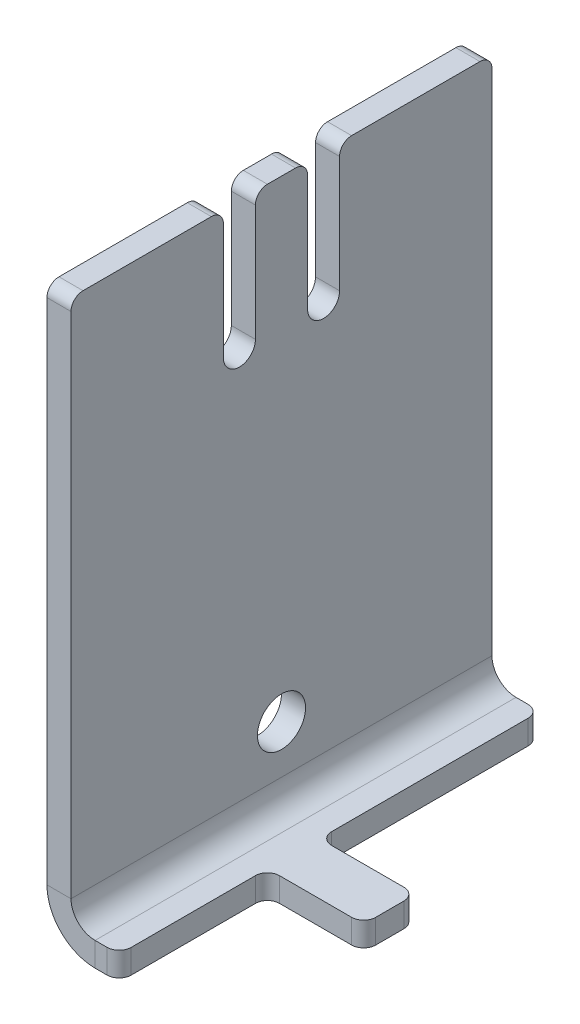
from build123d import *

# Parameters (mm, degrees)
BASE_FLANGE1_DEPTH       = 2
SKETCHED_BEND1_OUTLINE_W = 2
SKETCHED_BEND1_OUTLINE_H = 35
SKETCHED_BEND1_DEPTH     = 44.40715449
SKETCHED_START           = 45.98523449
SKETCHED_BEND1_2_DEPTH   = 0.01096
SKETCHED_START_2         = 43.99619449
SKETCHED_BEND1_3_DEPTH   = 4
SKETCHED_START_3         = -17.5
SKETCHED_BEND1_4_DEPTH   = 35
SKETCH7_R                = 2
CUT_EXTRUDE1_DEPTH       = 10


with BuildPart() as part:
    # Base-Flange1: sheet metal written as solids
    # Sketch1 → Base-Flange1 (new body)
    with BuildSketch(Plane(origin=(0, 0, 0), x_dir=(1, 0, 0), z_dir=(0, 1, 0))):
        with BuildLine():
            Line((0, 16.5), (0, 5.83))
            ThreePointArc((0, 5.83), (0.292893219, 5.122893219), (1, 4.83))
            Line((1, 4.83), (10.67, 4.83))
            ThreePointArc((10.67, 4.83), (12, 3.5), (10.67, 2.17))
            Line((10.67, 2.17), (1, 2.17))
            ThreePointArc((1, 2.17), (0.292893219, 1.877106781), (0, 1.17))
            Line((0, 1.17), (0, -1.17))
            ThreePointArc((0, -1.17), (0.292893219, -1.877106781), (1, -2.17))
            Line((1, -2.17), (10.67, -2.17))
            ThreePointArc((10.67, -2.17), (12, -3.5), (10.67, -4.83))
            Line((10.67, -4.83), (1, -4.83))
            ThreePointArc((1, -4.83), (0.292893219, -5.122893219), (0, -5.83))
            Line((0, -5.83), (0, -16.5))
            ThreePointArc((0, -16.5), (0.292893219, -17.207106781), (1, -17.5))
            Line((1, -17.5), (49, -17.5))
            ThreePointArc((49, -17.5), (49.707106781, -17.207106781), (50, -16.5))
            Line((50, -16.5), (50, -6.17))
            ThreePointArc((50, -6.17), (50.292893219, -5.462893219), (51, -5.17))
            Line((51, -5.17), (57, -5.17))
            ThreePointArc((57, -5.17), (57.707106781, -4.877106781), (58, -4.17))
            Line((58, -4.17), (58, -1.83))
            ThreePointArc((58, -1.83), (57.707106781, -1.122893219), (57, -0.83))
            Line((57, -0.83), (51, -0.83))
            ThreePointArc((51, -0.83), (50.292893219, -0.537106781), (50, 0.17))
            Line((50, 0.17), (50, 16.5))
            ThreePointArc((50, 16.5), (49.707106781, 17.207106781), (49, 17.5))
            Line((49, 17.5), (1, 17.5))
            ThreePointArc((1, 17.5), (0.292893219, 17.207106781), (0, 16.5))
        make_face()
    extrude(amount=-BASE_FLANGE1_DEPTH)

    # Sketched Bend1: read off the stored shape, not the designer's step
    # Sketched Bend1 outline → Sketched Bend1 (cut)
    with BuildSketch(Plane.YZ):
        with Locations((-1, 0)):
            Rectangle(SKETCHED_BEND1_OUTLINE_W, SKETCHED_BEND1_OUTLINE_H)
    extrude(amount=SKETCHED_BEND1_DEPTH, mode=Mode.SUBTRACT)

    # Sketched Bend1 2 outline → Sketched Bend1 2 (add)
    with BuildSketch(Plane.YZ.offset(SKETCHED_START)):
        with BuildLine():
            Line((0, -17.5), (44.28380551, -17.5))
            ThreePointArc((44.28380551, -17.5), (44.990912291, -17.207106781), (45.28380551, -16.5))
            Line((45.28380551, -16.5), (45.28380551, -5.83))
            ThreePointArc((45.28380551, -5.83), (44.990912291, -5.122893219), (44.28380551, -4.83))
            Line((44.28380551, -4.83), (34.61380551, -4.83))
            ThreePointArc((34.61380551, -4.83), (33.28380551, -3.5), (34.61380551, -2.17))
            Line((34.61380551, -2.17), (44.28380551, -2.17))
            ThreePointArc((44.28380551, -2.17), (44.990912291, -1.877106781), (45.28380551, -1.17))
            Line((45.28380551, -1.17), (45.28380551, 1.17))
            ThreePointArc((45.28380551, 1.17), (44.990912291, 1.877106781), (44.28380551, 2.17))
            Line((44.28380551, 2.17), (34.61380551, 2.17))
            ThreePointArc((34.61380551, 2.17), (33.28380551, 3.5), (34.61380551, 4.83))
            Line((34.61380551, 4.83), (44.28380551, 4.83))
            ThreePointArc((44.28380551, 4.83), (44.990912291, 5.122893219), (45.28380551, 5.83))
            Line((45.28380551, 5.83), (45.28380551, 16.5))
            ThreePointArc((45.28380551, 16.5), (44.990912291, 17.207106781), (44.28380551, 17.5))
            Line((44.28380551, 17.5), (0, 17.5))
            Line((0, 17.5), (0, -17.5))
        make_face()
    extrude(amount=SKETCHED_BEND1_2_DEPTH)

    # Sketched Bend1 3 outline → Sketched Bend1 3 (add)
    with BuildSketch(Plane.YZ.offset(SKETCHED_START_2)):
        with BuildLine():
            Line((0, -17.5), (44.28380551, -17.5))
            ThreePointArc((44.28380551, -17.5), (44.990912291, -17.207106781), (45.28380551, -16.5))
            Line((45.28380551, -16.5), (45.28380551, -5.83))
            ThreePointArc((45.28380551, -5.83), (44.990912291, -5.122893219), (44.28380551, -4.83))
            Line((44.28380551, -4.83), (34.61380551, -4.83))
            ThreePointArc((34.61380551, -4.83), (33.28380551, -3.5), (34.61380551, -2.17))
            Line((34.61380551, -2.17), (44.28380551, -2.17))
            ThreePointArc((44.28380551, -2.17), (44.990912291, -1.877106781), (45.28380551, -1.17))
            Line((45.28380551, -1.17), (45.28380551, 1.17))
            ThreePointArc((45.28380551, 1.17), (44.990912291, 1.877106781), (44.28380551, 2.17))
            Line((44.28380551, 2.17), (34.61380551, 2.17))
            ThreePointArc((34.61380551, 2.17), (33.28380551, 3.5), (34.61380551, 4.83))
            Line((34.61380551, 4.83), (44.28380551, 4.83))
            ThreePointArc((44.28380551, 4.83), (44.990912291, 5.122893219), (45.28380551, 5.83))
            Line((45.28380551, 5.83), (45.28380551, 16.5))
            ThreePointArc((45.28380551, 16.5), (44.990912291, 17.207106781), (44.28380551, 17.5))
            Line((44.28380551, 17.5), (0, 17.5))
            Line((0, 17.5), (0, -17.5))
        make_face()
    extrude(amount=SKETCHED_BEND1_3_DEPTH)

    # Sketched Bend1 4 outline → Sketched Bend1 4 (cut)
    with BuildSketch(Plane.XY.offset(SKETCHED_START_3)):
        with BuildLine():
            Line((47.99619449, 45.28380551), (45.99619449, 45.28380551))
            Line((45.99619449, 45.28380551), (45.99619449, 2))
            ThreePointArc((45.99619449, 2), (46.581980928, 0.585786438), (47.99619449, 0))
            Line((47.99619449, 0), (47.99619449, 45.28380551))
        make_face()
        with BuildLine():
            ThreePointArc((47.99619449, -2), (45.167767365, -0.828427125), (43.99619449, 2))
            Line((43.99619449, 2), (43.99619449, 0))
            Line((43.99619449, 0), (44.40715449, 0))
            Line((44.40715449, 0), (44.40715449, -2))
            Line((44.40715449, -2), (47.99619449, -2))
        make_face()
    extrude(amount=SKETCHED_BEND1_4_DEPTH, mode=Mode.SUBTRACT)

    # Sketch7 → Cut-Extrude1 (cut)
    with BuildSketch(Plane.ZY.offset(-43.99619449)):
        with Locations(Location((0, 6, 0), (0, 0, 270))):
            Circle(SKETCH7_R)
    extrude(amount=-CUT_EXTRUDE1_DEPTH, mode=Mode.SUBTRACT)


solid = part.part
